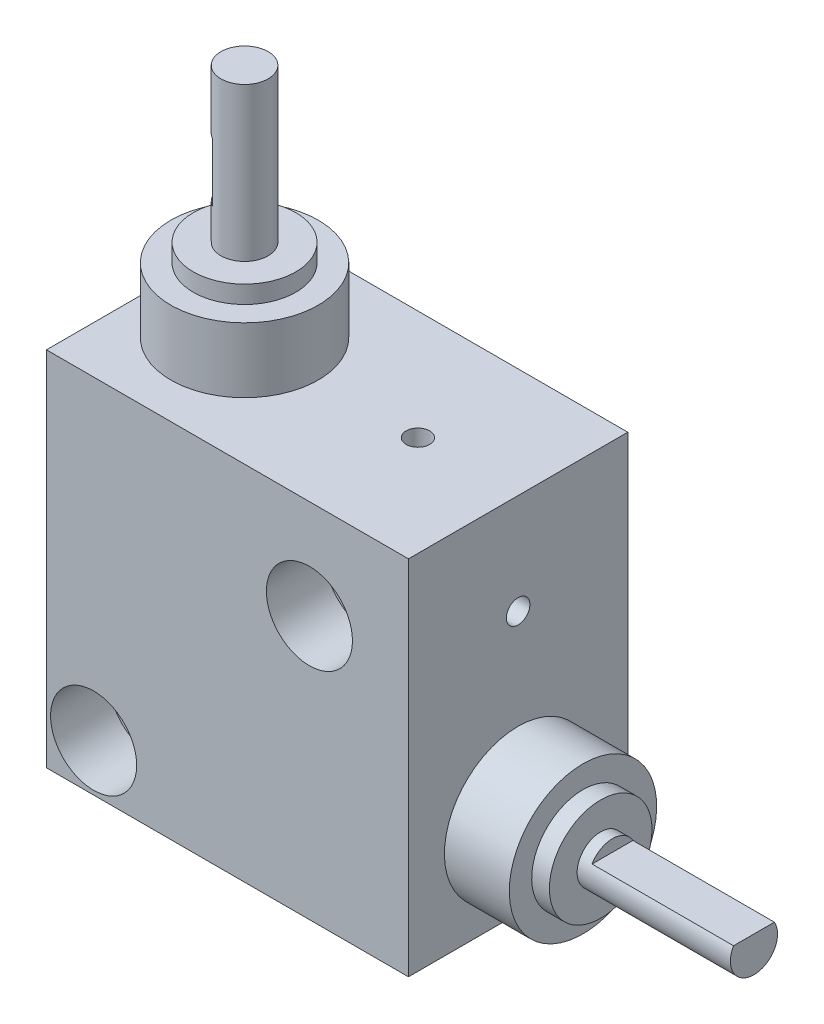
from build123d import *

# Parameters (mm, degrees)
ESQUISSE1_W             = 30.7
ESQUISSE1_H             = 30.7
BOSS_EXTRU_1_DEPTH      = 9.3
ESQUISSE2_R             = 2
ENL_V_MAT_EXTRU_1_DEPTH = 48.232827567
ESQUISSE3_R             = 3.65
ENL_V_MAT_EXTRU_2_DEPTH = 5
ENL_V_START             = -5
ESQUISSE4_R             = 3.65
ENL_V_MAT_EXTRU_3_DEPTH = 5
ESQUISSE9_W             = 1
ESQUISSE9_H             = 4
ENL_V_MAT_EXTRU_4_DEPTH = 5
ESQUISSE10_W            = 4
ESQUISSE10_H            = 1
ENL_V_MAT_EXTRU_5_DEPTH = 12
ESQUISSE11_R            = 1
ENL_V_MAT_EXTRU_6_DEPTH = 5
ESQUISSE13_R            = 1
ENL_V_MAT_EXTRU_7_DEPTH = 5


with BuildPart() as part:
    # Esquisse1 → Boss.-Extru.1 (new, symmetric)
    with BuildSketch(Plane.XY):
        with Locations((15.35, 15.35)):
            Rectangle(ESQUISSE1_W, ESQUISSE1_H)
    extrude(amount=BOSS_EXTRU_1_DEPTH, both=True)

    # Esquisse2 → Enlèv. mat.-Extru.1 (cut, through all)
    with BuildSketch(Plane.XY.offset(9.3)):
        with Locations((4, 4)):
            Circle(ESQUISSE2_R)
        with Locations((22.3, 22.3)):
            Circle(ESQUISSE2_R)
    extrude(amount=-ENL_V_MAT_EXTRU_1_DEPTH, mode=Mode.SUBTRACT)

    # Esquisse3 → Enlèv. mat.-Extru.2 (cut)
    with BuildSketch(Plane.XY.offset(9.3)):
        with Locations((4, 4)):
            Circle(ESQUISSE3_R)
        with Locations((22.3, 22.3)):
            Circle(ESQUISSE3_R)
    extrude(amount=-ENL_V_MAT_EXTRU_2_DEPTH, mode=Mode.SUBTRACT)

    # Esquisse4 → Enlèv. mat.-Extru.3 (cut)
    with BuildSketch(Plane(origin=(0, 0, -9.3), x_dir=(-1, 0, 0), z_dir=(0, 0, -1)).offset(ENL_V_START)):
        with Locations((-4, 4)):
            Circle(ESQUISSE4_R)
        with Locations((-22.3, 22.3)):
            Circle(ESQUISSE4_R)
    extrude(amount=ENL_V_MAT_EXTRU_3_DEPTH, mode=Mode.SUBTRACT)

    # Esquisse6 → Révolution1 (revolve)
    with BuildSketch(Plane.XY):
        Polygon((30.7, 13.75), (36.2, 13.75), (36.2, 11.85), (37.7, 11.85), (37.7, 9.5), (50.7, 9.5), (50.7, 7.5), (30.7, 7.5), align=None)
    revolve(axis=Axis((50.7, 7.5, 0), (-1, 0, 0)))

    # Esquisse10 → Enlèv. mat.-Extru.5 (cut)
    with BuildSketch(Plane(origin=(50.7, 0, 0), x_dir=(0, 0, -1), z_dir=(1, 0, 0))):
        with Locations((0, 9)):
            Rectangle(ESQUISSE10_W, ESQUISSE10_H)
    extrude(amount=-ENL_V_MAT_EXTRU_5_DEPTH, mode=Mode.SUBTRACT)

    # Esquisse11 → Enlèv. mat.-Extru.6 (cut)
    with BuildSketch(Plane(origin=(30.7, 0, 0), x_dir=(0, 0, -1), z_dir=(1, 0, 0))):
        with Locations((0, 22.2)):
            Circle(ESQUISSE11_R)
    extrude(amount=-ENL_V_MAT_EXTRU_6_DEPTH, mode=Mode.SUBTRACT)

    # Esquisse13 → Enlèv. mat.-Extru.7 (cut)
    with BuildSketch(Plane(origin=(0, 30.7, 0), x_dir=(1, 0, 0), z_dir=(0, 1, 0))):
        with Locations((22.2, 0)):
            Circle(ESQUISSE13_R)
    extrude(amount=-ENL_V_MAT_EXTRU_7_DEPTH, mode=Mode.SUBTRACT)


with BuildPart() as body_2:
    # Esquisse8 → Révolution2 (revolve)
    with BuildSketch(Plane.XY):
        Polygon((1.25, 30.7), (1.25, 36.2), (3.15, 36.2), (3.15, 37.7), (5.5, 37.7), (5.5, 50.7), (7.5, 50.7), (7.5, 30.7), align=None)
    revolve(axis=Axis((7.5, 50.7, 0), (0, -1, 0)))

    # Esquisse9 → Enlèv. mat.-Extru.4 (cut)
    with BuildSketch(Plane(origin=(0, 45.7, 0), x_dir=(1, 0, 0), z_dir=(0, 1, 0))):
        with Locations((6, 0)):
            Rectangle(ESQUISSE9_W, ESQUISSE9_H)
    extrude(amount=-ENL_V_MAT_EXTRU_4_DEPTH, mode=Mode.SUBTRACT)


solid = Compound([part.part, body_2.part])
